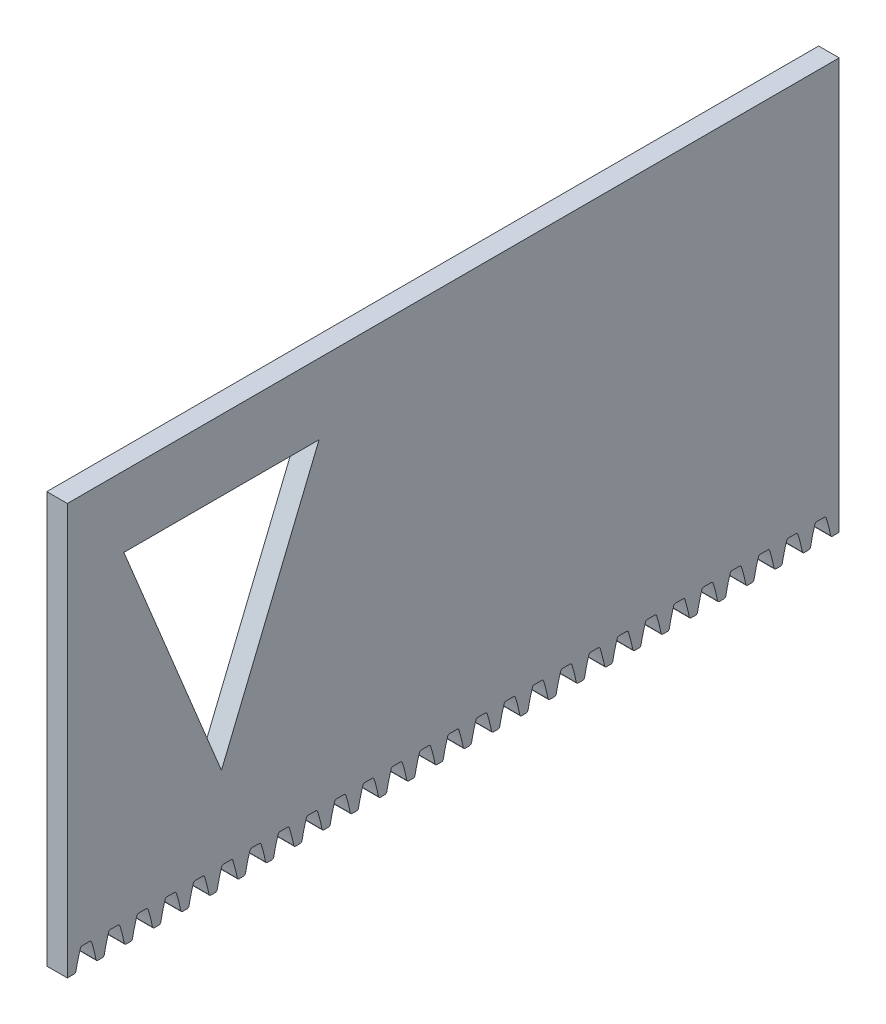
from build123d import *

# Parameters (mm, degrees)
BOSS_EXTRUDE1_DEPTH        = 2
CUT_EXTRUDE1_DEPTH         = 55.910042724
CUT_EXTRUDE2_DEPTH         = 55.910042724
FILLET1_R                  = 0.2
LPATTERN1_COUNT            = 14
LPATTERN1_PITCH            = 2.75
FILLET1_OF_LPATTERN1_R     = 0.2
LPATTERN1_COL_COUNT        = 14
LPATTERN1_COL_PITCH        = 2.75
FILLET1_OF_LPATTERN1_COL_R = 0.2


with BuildPart() as part:
    # Sketch1 → Boss-Extrude1 (new body)
    with BuildSketch(Plane(origin=(0, 0, 0), x_dir=(0, 0, -1), z_dir=(1, 0, 0))):
        Polygon((-20, 0), (20, 0), (37.564781272, 0), (37.564781272, 40), (-37.564781272, 40), (-37.564781272, 0), align=None)
    extrude(amount=BOSS_EXTRUDE1_DEPTH)

    # Sketch2 → Cut-Extrude1 (cut, through all)
    with BuildSketch(Plane.ZY):
        Polygon((22.564781272, 10), (13.064781272, 33.12466216), (32.064781272, 33.12466216), align=None)
    extrude(amount=-CUT_EXTRUDE1_DEPTH, mode=Mode.SUBTRACT)

    # Sketch3 → Cut-Extrude2 (cut, through all)
    with BuildSketch(Plane.ZY):
        with BuildLine():
            Line((-0.5, 2), (0.5, 2))
            ThreePointArc((0.5, 2), (0.784399873, 1.008599968), (1, 0))
            Line((1, 0), (-1, 0))
            ThreePointArc((-1, 0), (-0.784399873, 1.008599968), (-0.5, 2))
        make_face()
    cut_extrude2 = extrude(amount=-CUT_EXTRUDE2_DEPTH, mode=Mode.SUBTRACT)

    # Fillet1
    fillet1_edges = [part.edges().sort_by_distance(p)[0] for p in [
        (1, 2, -0.5),
        (1, 2, 0.5),
        (1, 0, 1),
        (1, 0, -1),
    ]]
    fillet(fillet1_edges, radius=FILLET1_R)

    # LPattern1: Cut-Extrude2 ×14
    with Locations(*[(0, 0, i * LPATTERN1_PITCH) for i in range(1, LPATTERN1_COUNT)]):
        add(cut_extrude2, mode=Mode.SUBTRACT)

    # Fillet1 of LPattern1
    fillet1_of_lpattern1_edges = [part.edges().sort_by_distance(p)[0] for p in [
        (1, 2, 2.25),
        (1, 2, 3.25),
        (1, 0, 3.75),
        (1, 0, 1.75),
        (1, 2, 5),
        (1, 2, 6),
        (1, 0, 6.5),
        (1, 0, 4.5),
        (1, 2, 7.75),
        (1, 2, 8.75),
        (1, 0, 9.25),
        (1, 0, 7.25),
        (1, 2, 10.5),
        (1, 2, 11.5),
        (1, 0, 12),
        (1, 0, 10),
        (1, 2, 13.25),
        (1, 2, 14.25),
        (1, 0, 14.75),
        (1, 0, 12.75),
        (1, 2, 16),
        (1, 2, 17),
        (1, 0, 17.5),
        (1, 0, 15.5),
        (1, 2, 18.75),
        (1, 2, 19.75),
        (1, 0, 20.25),
        (1, 0, 18.25),
        (1, 2, 21.5),
        (1, 2, 22.5),
        (1, 0, 23),
        (1, 0, 21),
        (1, 2, 24.25),
        (1, 2, 25.25),
        (1, 0, 25.75),
        (1, 0, 23.75),
        (1, 2, 27),
        (1, 2, 28),
        (1, 0, 28.5),
        (1, 0, 26.5),
        (1, 2, 29.75),
        (1, 2, 30.75),
        (1, 0, 31.25),
        (1, 0, 29.25),
        (1, 2, 32.5),
        (1, 2, 33.5),
        (1, 0, 34),
        (1, 0, 32),
        (1, 2, 35.25),
        (1, 2, 36.25),
        (1, 0, 36.75),
        (1, 0, 34.75),
    ]]
    fillet(fillet1_of_lpattern1_edges, radius=FILLET1_OF_LPATTERN1_R)

    # LPattern1 col: Cut-Extrude2 ×14
    with Locations(*[(0, 0, -i * LPATTERN1_COL_PITCH) for i in range(1, LPATTERN1_COL_COUNT)]):
        add(cut_extrude2, mode=Mode.SUBTRACT)

    # Fillet1 of LPattern1 col
    fillet1_of_lpattern1_col_edges = [part.edges().sort_by_distance(p)[0] for p in [
        (1, 2, -3.25),
        (1, 2, -2.25),
        (1, 0, -1.75),
        (1, 0, -3.75),
        (1, 2, -6),
        (1, 2, -5),
        (1, 0, -4.5),
        (1, 0, -6.5),
        (1, 2, -8.75),
        (1, 2, -7.75),
        (1, 0, -7.25),
        (1, 0, -9.25),
        (1, 2, -11.5),
        (1, 2, -10.5),
        (1, 0, -10),
        (1, 0, -12),
        (1, 2, -14.25),
        (1, 2, -13.25),
        (1, 0, -12.75),
        (1, 0, -14.75),
        (1, 2, -17),
        (1, 2, -16),
        (1, 0, -15.5),
        (1, 0, -17.5),
        (1, 2, -19.75),
        (1, 2, -18.75),
        (1, 0, -18.25),
        (1, 0, -20.25),
        (1, 2, -22.5),
        (1, 2, -21.5),
        (1, 0, -21),
        (1, 0, -23),
        (1, 2, -25.25),
        (1, 2, -24.25),
        (1, 0, -23.75),
        (1, 0, -25.75),
        (1, 2, -28),
        (1, 2, -27),
        (1, 0, -26.5),
        (1, 0, -28.5),
        (1, 2, -30.75),
        (1, 2, -29.75),
        (1, 0, -29.25),
        (1, 0, -31.25),
        (1, 2, -33.5),
        (1, 2, -32.5),
        (1, 0, -32),
        (1, 0, -34),
        (1, 2, -36.25),
        (1, 2, -35.25),
        (1, 0, -34.75),
        (1, 0, -36.75),
    ]]
    fillet(fillet1_of_lpattern1_col_edges, radius=FILLET1_OF_LPATTERN1_COL_R)


solid = part.part
